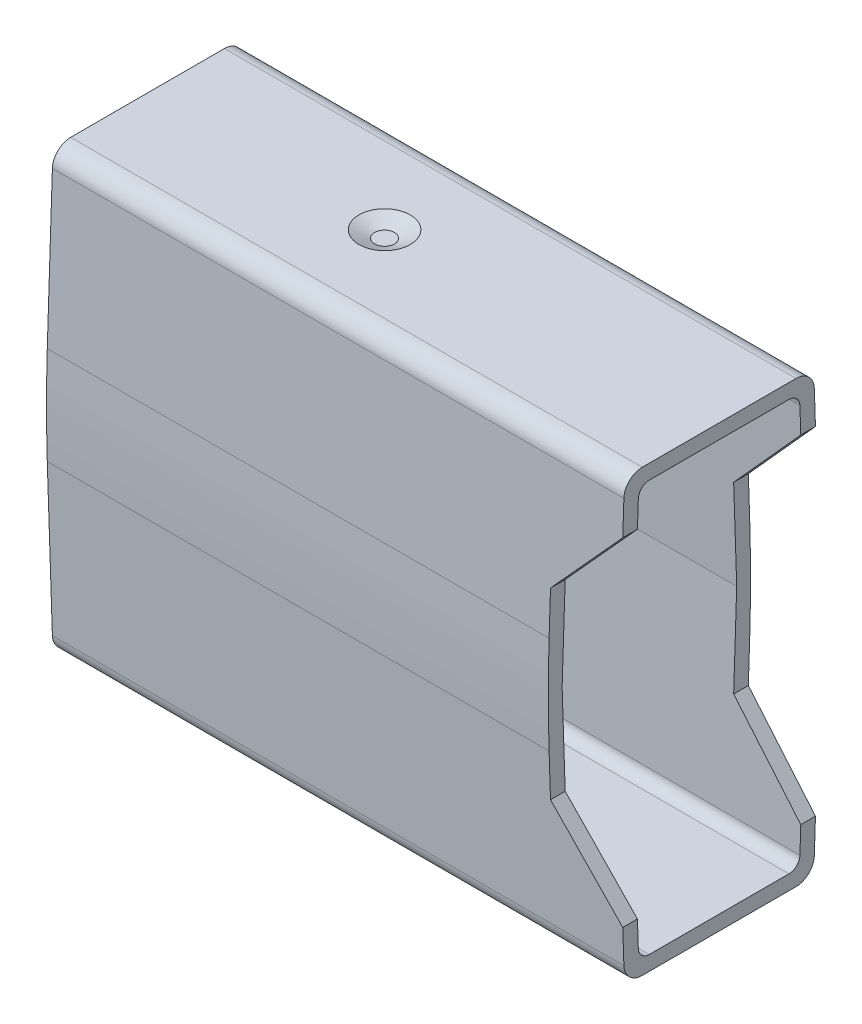
from build123d import *
from build123d.topology import SkipClean

# Parameters (mm, degrees)
SKETCH1_W                     = 80.645
SKETCH1_H                     = 7.0612
BOSS_EXTRUDE1_DEPTH           = 7.62
BOSS_EXTRUDE1_TAPER           = 1.909
BOSS_EXTRUDE1_OTHER_WAY_DEPTH = 7.62
BOSS_EXTRUDE1_OTHER_WAY_TAPER = 1.909
CUT_EXTRUDE1_DEPTH            = 82.311382902
FILLET2_R                     = 0.635
FILLET3_R                     = 0.381
FILLET4_R                     = 50.8
BOSS_EXTRUDE2_DEPTH           = 80.645
CUT_EXTRUDE2_DEPTH            = 82.308937972
SKETCH7_R                     = 0.635
CUT_EXTRUDE3_DEPTH            = 1.27
SKETCH8_R                     = 0.889
CUT_EXTRUDE4_DEPTH            = 0.254
CUT_EXTRUDE4_DRAFT            = -65
SKETCH9_R                     = 0.889
CUT_EXTRUDE5_DEPTH            = 0.254
CUT_EXTRUDE5_DRAFT            = -65
CUT_EXTRUDE6_START            = 6.175959195
CUT_EXTRUDE6_DEPTH            = 0.881321808
BOSS_EXTRUDE3_REACH           = 83.309
CUT_EXTRUDE7_DEPTH            = 83.373154581
CUT_EXTRUDE7_DEPTH_BACK       = 83.373154581
SKETCH13_W                    = 68.940924303
SKETCH13_H                    = 22.731753013


# Read off the part's stored shape, not the designer's step: Cut-Extrude6
with BuildPart() as part:
    # Sketch1 → Boss-Extrude1 (new body)
    with BuildSketch(Plane(origin=(0, 0, 0), x_dir=(1, 0, 0), z_dir=(0, 1, 0))):
        with Locations((40.3225, 3.5306)):
            Rectangle(SKETCH1_W, SKETCH1_H)
    extrude(amount=BOSS_EXTRUDE1_DEPTH, taper=BOSS_EXTRUDE1_TAPER)

    # Sketch1 → Boss-Extrude1 other way (add)
    with BuildSketch(Plane(origin=(0, 0, 0), x_dir=(1, 0, 0), z_dir=(0, 1, 0))):
        with Locations((40.3225, 3.5306)):
            Rectangle(SKETCH1_W, SKETCH1_H)
    extrude(amount=-BOSS_EXTRUDE1_OTHER_WAY_DEPTH, taper=BOSS_EXTRUDE1_OTHER_WAY_TAPER)

    # Sketch4 → Cut-Extrude1 (cut, through all)
    with BuildSketch(Plane(origin=(0, 0, 0), x_dir=(0, 0, -1), z_dir=(1, 0, 0))):
        Polygon((6.552917901, 0), (6.315870177, 7.112), (0.745329823, 7.112), (0.508282099, 0), (0.745329823, -7.112), (6.315870177, -7.112), align=None)
    extrude(amount=CUT_EXTRUDE1_DEPTH, mode=Mode.SUBTRACT)

    # Fillet2
    fillet2_edges = [part.edges().sort_by_distance(p)[0] for p in [
        (40.3225, -7.62, -6.807220295),
        (40.3225, 7.62, -0.253979705),
        (40.3225, 7.62, -6.807220295),
        (40.3225, -7.62, -0.253979705),
    ]]
    fillet(fillet2_edges, radius=FILLET2_R)

    # Fillet3
    fillet3_edges = [part.edges().sort_by_distance(p)[0] for p in [
        (40.3225, 7.112, -6.315870177),
        (40.3225, 7.112, -0.745329823),
        (40.3225, -7.112, -6.315870177),
        (40.3225, -7.112, -0.745329823),
    ]]
    fillet(fillet3_edges, radius=FILLET3_R)

    # Fillet4
    # the kernel refuses this fillet: 50.8 mm, written as the material it takes off along each edge
    with BuildSketch(Plane(origin=(84.87799508, 0, -7.0612), x_dir=(0, 0.9994449956083129, 0.03331217125165235), z_dir=(-1, 0, 0)), Plane(origin=(-4.23299508, 0, 0), x_dir=(0, 0.999444995608313, -0.03331217125165188), z_dir=(1, 0, 0))) as fillet4_piece_1:
        with BuildLine():
            CenterArc((FILLET4_R * 0.0333306699198, -FILLET4_R), FILLET4_R, 90, 3.818)
            Line((-FILLET4_R * 0.0332566957808, -FILLET4_R * 0.002219401507), (0, 0))
            Line((0, 0), (FILLET4_R * 0.0333306699198, 0))
        make_face()
    extrude(amount=89.11099016, mode=Mode.SUBTRACT)

    # Sketch5 → Boss-Extrude2 (add)
    with SkipClean():  # the faces are left unmerged after this step: merging them gives an invalid solid
        with BuildSketch(Plane(origin=(0, 0, 0), x_dir=(0, 0, -1), z_dir=(1, 0, 0))):
            with BuildLine():
                Line((6.827680219, 7.006153229), (7.004795897, 1.6922583))
                ThreePointArc((7.004795897, 1.6922583), (7.025941075, 0.846246576), (7.03299012, 0))
                ThreePointArc((7.03299012, 0), (7.025941075, -0.846246576), (7.004795897, -1.6922583))
                Line((7.004795897, -1.6922583), (6.827680219, -7.006153229))
                ThreePointArc((6.827680219, -7.006153229), (6.634503314, -7.441430334), (6.193032647, -7.62))
                Line((6.193032647, -7.62), (0.868167353, -7.62))
                ThreePointArc((0.868167353, -7.62), (0.426696686, -7.441430334), (0.233519781, -7.006153229))
                Line((0.233519781, -7.006153229), (0.056404103, -1.6922583))
                ThreePointArc((0.056404103, -1.6922583), (0.035258925, -0.846246576), (0.02820988, 0))
                ThreePointArc((0.02820988, 0), (0.035258925, 0.846246576), (0.056404103, 1.6922583))
                Line((0.056404103, 1.6922583), (0.233519781, 7.006153229))
                ThreePointArc((0.233519781, 7.006153229), (0.426696686, 7.441430334), (0.868167353, 7.62))
                Line((0.868167353, 7.62), (6.193032647, 7.62))
                ThreePointArc((6.193032647, 7.62), (6.634503314, 7.441430334), (6.827680219, 7.006153229))
            make_face()
            with BuildLine():
                Line((6.328146131, 6.743691937), (6.552917901, 0))
                Line((6.552917901, 0), (6.328146131, -6.743691937))
                ThreePointArc((6.328146131, -6.743691937), (6.212239988, -7.004858201), (5.947357588, -7.112))
                Line((5.947357588, -7.112), (1.113842412, -7.112))
                ThreePointArc((1.113842412, -7.112), (0.848960012, -7.004858201), (0.733053869, -6.743691937))
                Line((0.733053869, -6.743691937), (0.508282099, 0))
                Line((0.508282099, 0), (0.733053869, 6.743691937))
                ThreePointArc((0.733053869, 6.743691937), (0.848960012, 7.004858201), (1.113842412, 7.112))
                Line((1.113842412, 7.112), (5.947357588, 7.112))
                ThreePointArc((5.947357588, 7.112), (6.212239988, 7.004858201), (6.328146131, 6.743691937))
            make_face(mode=Mode.SUBTRACT)
        extrude(amount=BOSS_EXTRUDE2_DEPTH)

    # Sketch6 → Cut-Extrude2 (cut, through all)
    with SkipClean():  # the faces are left unmerged after this step: merging them gives an invalid solid
        with BuildSketch(Plane.XY):
            Polygon((80.645, 5.842), (80.645, -5.842), (78.232, -3.175), (78.232, 3.175), align=None)
        extrude(amount=-CUT_EXTRUDE2_DEPTH, mode=Mode.SUBTRACT)

    # Sketch7 → Cut-Extrude3 (cut)
    with SkipClean():  # the faces are left unmerged after this step: merging them gives an invalid solid
        with BuildSketch(Plane.XY):
            with Locations((58.4708, 0)):
                Circle(SKETCH7_R)
        extrude(amount=-CUT_EXTRUDE3_DEPTH, mode=Mode.SUBTRACT)


with BuildPart() as cut_extrude4_tool:
    # Sketch8 → Cut-Extrude4 (with draft: the straight prism first)
    with BuildSketch(Plane(origin=(0, -7.62, 0), x_dir=(-1, 0, 0), z_dir=(0, -1, 0))):
        with Locations((-69.0626, 3.5306)):
            Circle(SKETCH8_R)
    extrude(amount=-CUT_EXTRUDE4_DEPTH)
    # Cut-Extrude4: the draft: its side faces are tilted about the plane it starts from
    cut_extrude4_sides = [cut_extrude4_tool.faces().sort_by_distance(p)[0] for p in [
        (69.9516, -7.493, -3.5306),
    ]]
    draft(cut_extrude4_sides, Plane(origin=(0, -7.62, 0), x_dir=(-1, 0, 0), z_dir=(0, -1, 0)), CUT_EXTRUDE4_DRAFT)


with BuildPart() as part_1:
    add(part.part)

    # Cut-Extrude4: cut by cut_extrude4_tool
    add(cut_extrude4_tool.part, mode=Mode.SUBTRACT)


with BuildPart() as cut_extrude5_tool:
    # Sketch9 → Cut-Extrude5 (with draft: the straight prism first)
    with BuildSketch(Plane(origin=(0, 7.62, 0), x_dir=(1, 0, 0), z_dir=(0, 1, 0))):
        with Locations((69.0626, 3.5306)):
            Circle(SKETCH9_R)
    extrude(amount=-CUT_EXTRUDE5_DEPTH)
    # Cut-Extrude5: the draft: its side faces are tilted about the plane it starts from
    cut_extrude5_sides = [cut_extrude5_tool.faces().sort_by_distance(p)[0] for p in [
        (68.1736, 7.493, -3.5306),
    ]]
    draft(cut_extrude5_sides, Plane(origin=(0, 7.62, 0), x_dir=(1, 0, 0), z_dir=(0, 1, 0)), CUT_EXTRUDE5_DRAFT)


with BuildPart() as part_2:
    add(part_1.part)

    # Cut-Extrude5: cut by cut_extrude5_tool
    add(cut_extrude5_tool.part, mode=Mode.SUBTRACT)

    # Cut-Extrude6 outline → Cut-Extrude6 (cut)
    with SkipClean():  # the faces are left unmerged after this step: merging them gives an invalid solid
        with BuildSketch(Plane(origin=(0, 0, 0), x_dir=(1, 0, 0), z_dir=(0, 0.0333121712516467, -0.9994449956083131)).offset(CUT_EXTRUDE6_START)):
            with BuildLine():
                Line((3.175214283, -5.357453783), (3.810214283, -5.357453783))
                add(Edge.make_bspline(
                    [(3.810214283, -5.357453783), (3.810214283, -4.468947182), (4.699214283, -4.468947182)],
                    knots=[0, 0, 0, 1.570796327, 1.570796327, 1.570796327], degree=2, weights=[1, 0.707106781, 1]))
                Line((4.699214283, -4.468947182), (8.001214283, -4.468947182))
                Line((8.001214283, -4.468947182), (8.001214283, -3.834299609))
                Line((8.001214283, -3.834299609), (4.699214283, -3.834299609))
                add(Edge.make_bspline(
                    [(4.699214283, -3.834299609), (3.175214283, -3.834299609), (3.175214283, -5.357453783)],
                    knots=[3.141592654, 3.141592654, 3.141592654, 4.71238898, 4.71238898, 4.71238898], degree=2, weights=[1, 0.707106781, 1]))
            make_face()
            with BuildLine():
                Line((8.001214283, -2.522694796), (4.699214283, -2.522694796))
                add(Edge.make_bspline(
                    [(4.699214283, -2.522694796), (3.810214283, -2.522694796), (3.810214283, -1.634188195), (3.810214283, -0.745681594), (4.699214283, -0.745681594)],
                    knots=[0, 0, 0, 1.570796327, 1.570796327, 3.141592654, 3.141592654, 3.141592654], degree=2, weights=[1, 0.707106781, 1, 0.707106781, 1]))
                Line((4.699214283, -0.745681594), (8.001214283, -0.745681594))
                Line((8.001214283, -0.745681594), (8.001214283, -0.111034022))
                Line((8.001214283, -0.111034022), (4.699214283, -0.111034022))
                add(Edge.make_bspline(
                    [(4.699214283, -0.111034022), (3.175214283, -0.111034022), (3.175214283, -1.634188195), (3.175214283, -3.157342368), (4.699214283, -3.157342368)],
                    knots=[1.570796327, 1.570796327, 1.570796327, 3.141592654, 3.141592654, 4.71238898, 4.71238898, 4.71238898], degree=2, weights=[1, 0.707106781, 1, 0.707106781, 1]))
                Line((4.699214283, -3.157342368), (8.001214283, -3.157342368))
                Line((8.001214283, -3.157342368), (8.001214283, -2.522694796))
            make_face()
            with BuildLine():
                Line((3.810214283, 5.812343488), (3.175214283, 5.812343488))
                add(Edge.make_bspline(
                    [(3.175214283, 5.812343488), (3.175214283, 4.289189315), (4.699214283, 4.289189315)],
                    knots=[3.141592654, 3.141592654, 3.141592654, 4.71238898, 4.71238898, 4.71238898], degree=2, weights=[1, 0.707106781, 1]))
                Line((4.699214283, 4.289189315), (8.001214283, 4.289189315))
                Line((8.001214283, 4.289189315), (8.001214283, 4.923836887))
                Line((8.001214283, 4.923836887), (4.699214283, 4.923836887))
                add(Edge.make_bspline(
                    [(4.699214283, 4.923836887), (3.810214283, 4.923836887), (3.810214283, 5.812343488)],
                    knots=[1.570796327, 1.570796327, 1.570796327, 3.141592654, 3.141592654, 3.141592654], degree=2, weights=[1, 0.707106781, 1]))
            make_face()
            with BuildLine():
                Line((8.001214283, 3.612232074), (4.699214283, 3.612232074))
                add(Edge.make_bspline(
                    [(4.699214283, 3.612232074), (3.175214283, 3.612232074), (3.175214283, 2.0890779), (3.175214283, 0.565923727), (4.699214283, 0.565923727)],
                    knots=[0, 0, 0, 1.570796327, 1.570796327, 3.141592654, 3.141592654, 3.141592654], degree=2, weights=[1, 0.707106781, 1, 0.707106781, 1]))
                Line((4.699214283, 0.565923727), (8.001214283, 0.565923727))
                Line((8.001214283, 0.565923727), (8.001214283, 1.200571299))
                Line((8.001214283, 1.200571299), (4.699214283, 1.200571299))
                add(Edge.make_bspline(
                    [(4.699214283, 1.200571299), (3.810214283, 1.200571299), (3.810214283, 2.0890779), (3.810214283, 2.977584502), (4.699214283, 2.977584502)],
                    knots=[0, 0, 0, 1.570796327, 1.570796327, 3.141592654, 3.141592654, 3.141592654], degree=2, weights=[1, 0.707106781, 1, 0.707106781, 1]))
                Line((4.699214283, 2.977584502), (8.001214283, 2.977584502))
                Line((8.001214283, 2.977584502), (8.001214283, 3.612232074))
            make_face()
        extrude(amount=CUT_EXTRUDE6_DEPTH, mode=Mode.SUBTRACT)

    # Boss-Extrude3: up to this face of the body (flat: up to its plane)
    boss_extrude3_end = Plane(part_2.part.faces().sort_by_distance((8.001214283, -0.659158971, -6.779580355))[0])
    # Sketch12 → Boss-Extrude3 (add, up to the picked face)
    with BuildSketch(Plane.ZY, mode=Mode.PRIVATE) as boss_extrude3_sk1:
        Polygon((-6.954024091, 1.690566041), (-6.776908414, 7.00446097), (-6.328146131, 6.743691937), (-6.552917901, 0), (-6.328146131, -6.743691937), (-6.776908414, -7.00446097), (-6.954024091, -1.690566041), (-7.01037179, 0), align=None)
    boss_extrude3_tool1 = split(extrude(boss_extrude3_sk1.sketch, amount=-BOSS_EXTRUDE3_REACH, mode=Mode.PRIVATE), bisect_by=boss_extrude3_end, keep=Keep.BOTH, mode=Mode.PRIVATE)
    add(boss_extrude3_tool1.solids().sort_by(Axis((0, 0, -6.668518), (1, 0, 0)))[0])

    # Sketch13 → Cut-Extrude7 (cut, two sides: drawn at the far end of the back side and taken through both)
    with BuildSketch(Plane(origin=(0, 7.62, 0), x_dir=(1, 0, 0), z_dir=(0, 1, 0)).offset(-CUT_EXTRUDE7_DEPTH_BACK)):
        with Locations((26.386659588, 2.567952151)):
            Rectangle(SKETCH13_W, SKETCH13_H)
    extrude(amount=CUT_EXTRUDE7_DEPTH + CUT_EXTRUDE7_DEPTH_BACK, mode=Mode.SUBTRACT)


solid = part_2.part
